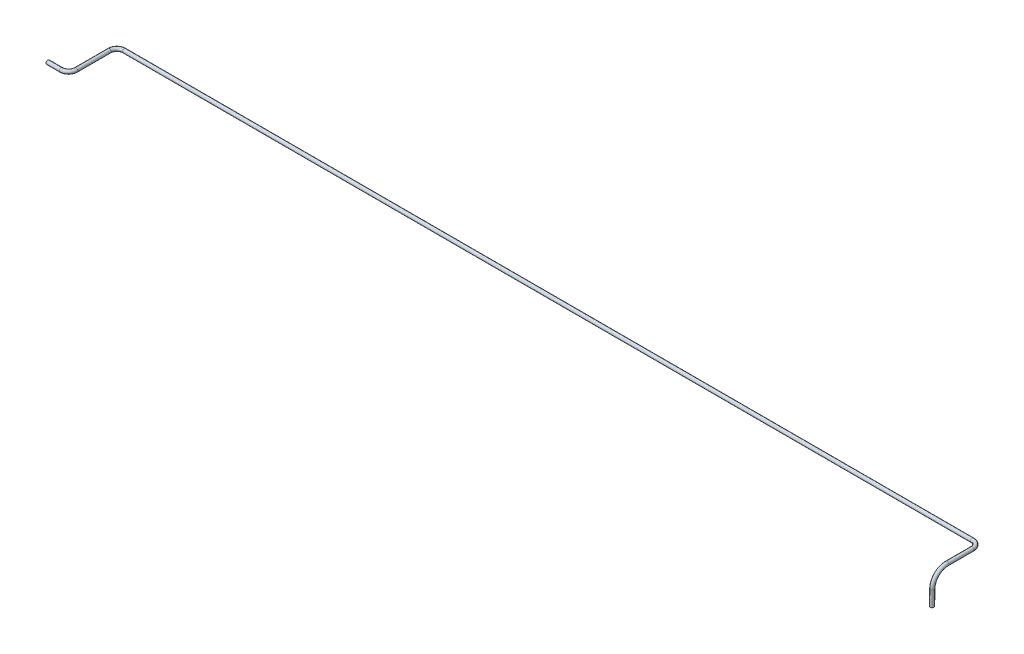
from build123d import *

# Parameters (mm, degrees)
SKETCH5_R   = 3.175
SKETCH5_R_2 = 2.667


with BuildPart() as part:
    # Sweep3: sweep along a curve in space
    with BuildLine() as sweep3_path:
        Line((0, 0, 0), (22.86, 0, 0))
        ThreePointArc((22.86, 0, 0), (31.840256121, 0, -3.719743879), (35.56, 0, -12.7))
        Line((35.56, 0, -12.7), (35.56, 0, -69.85))
        ThreePointArc((35.56, 0, -69.85), (39.279743879, 0, -78.830256121), (48.26, 0, -82.55))
        Line((48.26, 0, -82.55), (1499.658710354, 0, -82.55))
        ThreePointArc((1512.358710354, 0, -69.85), (1508.638966475, 0, -78.830256121), (1499.658710354, 0, -82.55))
        Line((1512.358710354, 0, -69.85), (1512.358710354, 0, -26.738510483))
        ThreePointArc((1512.358710354, 0, -26.738510483), (1512.358709946, -7.283438591, -8.93541517), (1512.358708957, -24.956708876, -1.342379026))
        Line((1512.358708957, -24.956708876, -1.342379026), (1512.358707512, -50.792262914, -0.891417753))
    # Sketch5 → Sweep3 (sweep)
    with BuildSketch(Plane(origin=(0, 0, 0), x_dir=(0, 0, -1), z_dir=(1, 0, 0))):
        Circle(SKETCH5_R)
        Circle(SKETCH5_R_2, mode=Mode.SUBTRACT)
    sweep(path=sweep3_path.line)


solid = part.part
